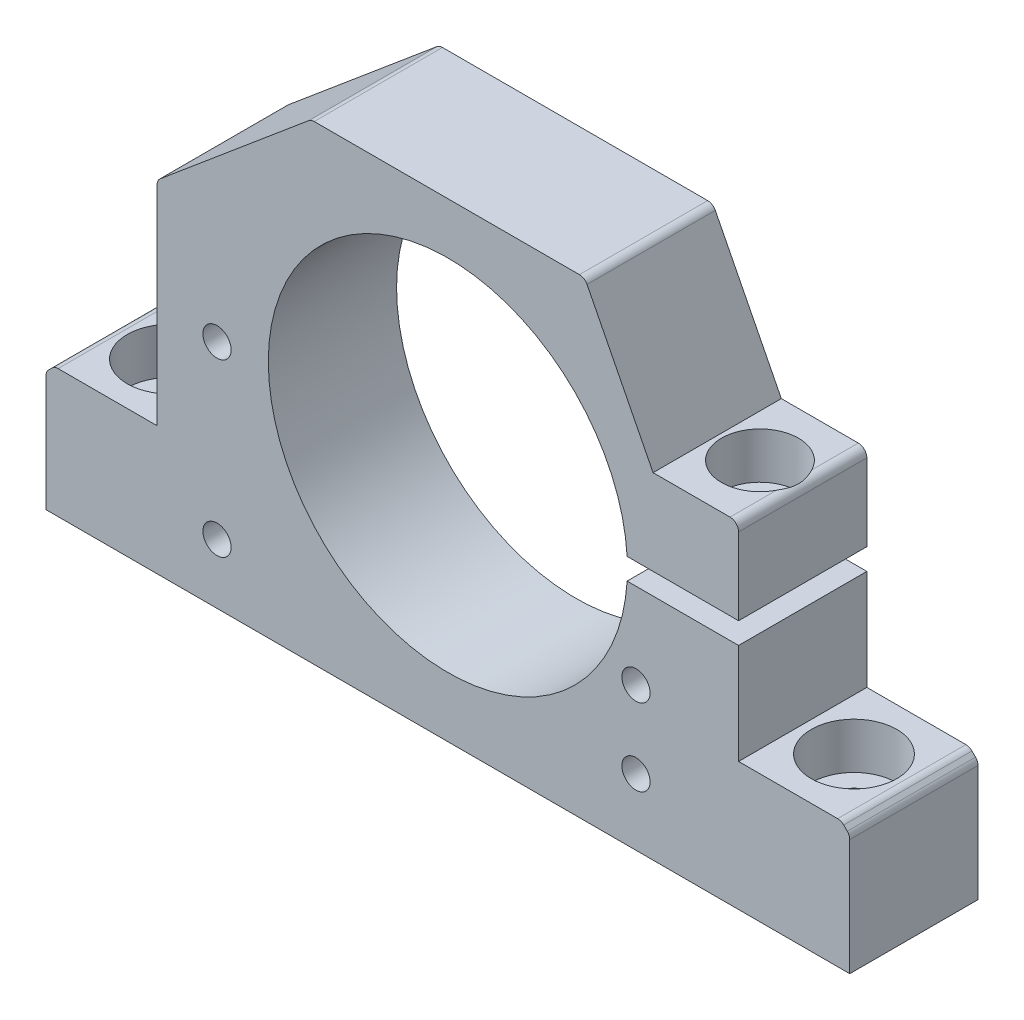
from build123d import *

# Parameters (mm, degrees)
SKETCH1_R                                            = 21
BOSS_EXTRUDE1_DEPTH                                  = 15
SKETCH2_W                                            = 42.201264836
SKETCH2_H                                            = 2.5
CUT_EXTRUDE1_DEPTH                                   = 15
CUT_EXTRUDE2_DEPTH                                   = 15
CBORE_SLOT_FOR_M5_HEX_SOCKET_HEAD_CAP_SC_D           = 5.5
CBORE_SLOT_FOR_M5_HEX_SOCKET_HEAD_CAP_SC_CBORE_D     = 10
CBORE_SLOT_FOR_M5_HEX_SOCKET_HEAD_CAP_SC_CBORE_DEPTH = 5.4
CBORE_FOR_M5_HEX_SOCKET_HEAD_CAP_SCREW1_D            = 5.5
CBORE_FOR_M5_HEX_SOCKET_HEAD_CAP_SCREW1_DEPTH        = 10
CBORE_FOR_M5_HEX_SOCKET_HEAD_CAP_SCREW1_CBORE_D      = 9
CBORE_FOR_M5_HEX_SOCKET_HEAD_CAP_SCREW1_CBORE_DEPTH  = 5.4
CHAMFER1_SIZE                                        = 1
M4_TAPPED_HOLE1_D                                    = 3.3
M5_TAPPED_HOLE1_D                                    = 4.2
M5_TAPPED_HOLE1_DEPTH                                = 18
M5_TAPPED_HOLE1_TIP                                  = 1.2618073
CHAMFER2_SIZE                                        = 18
CHAMFER2_SIZE2                                       = 15.103793361
FILLET1_R                                            = 1


with BuildPart() as part:
    # Sketch1 → Boss-Extrude1 (new body)
    with BuildSketch(Plane.XY):
        Polygon((47, -28), (-47, -28), (-47, -13), (-34, -13), (-34, 27), (34, 27), (34, -13), (47, -13), align=None)
        Circle(SKETCH1_R, mode=Mode.SUBTRACT)
    extrude(amount=BOSS_EXTRUDE1_DEPTH)

    # Sketch2 → Cut-Extrude1 (cut)
    with BuildSketch(Plane.XY.offset(15)):
        with Locations((34, 0)):
            Rectangle(SKETCH2_W, SKETCH2_H)
    extrude(amount=-CUT_EXTRUDE1_DEPTH, mode=Mode.SUBTRACT)

    # Sketch3 → Cut-Extrude2 (cut)
    with BuildSketch(Plane.XY.offset(15)):
        Polygon((34, 27), (16, 27), (24, 11.25), (34, 11.25), align=None)
    extrude(amount=-CUT_EXTRUDE2_DEPTH, mode=Mode.SUBTRACT)

    # CBORE SLOT for M5 Hex Socket Head Cap Screw1 (through all)
    with Locations(Plane(origin=(0, -13, 0), x_dir=(1, 0, 0), z_dir=(0, 1, 0))):
        with Locations((-40, -7.5), (40, -7.5)):
            CounterBoreHole(CBORE_SLOT_FOR_M5_HEX_SOCKET_HEAD_CAP_SC_D / 2, CBORE_SLOT_FOR_M5_HEX_SOCKET_HEAD_CAP_SC_CBORE_D / 2, CBORE_SLOT_FOR_M5_HEX_SOCKET_HEAD_CAP_SC_CBORE_DEPTH)

    # CBORE for M5 Hex Socket Head Cap Screw1
    with Locations(Plane(origin=(29, 11.25, 7.5), x_dir=(0, 0, 1), z_dir=(0, 1, 0))):
        with Locations((0, 0)):
            CounterBoreHole(CBORE_FOR_M5_HEX_SOCKET_HEAD_CAP_SCREW1_D / 2, CBORE_FOR_M5_HEX_SOCKET_HEAD_CAP_SCREW1_CBORE_D / 2, CBORE_FOR_M5_HEX_SOCKET_HEAD_CAP_SCREW1_CBORE_DEPTH, depth=CBORE_FOR_M5_HEX_SOCKET_HEAD_CAP_SCREW1_DEPTH)

    # Chamfer1
    chamfer1_edges = [part.edges().sort_by_distance(p)[0] for p in [
        (47, -13, 7.5),
        (-47, -13, 7.5),
    ]]
    chamfer(chamfer1_edges, length=CHAMFER1_SIZE)

    # M4 Tapped Hole1 (through all)
    with Locations(Plane(origin=(-27, -21, 15), x_dir=(1, 0, 0), z_dir=(0, 0, 1))):
        with Locations((0, 0), (0, 20), (49, 0.741264898), (49, 9.75)):
            Hole(M4_TAPPED_HOLE1_D / 2)

    # M5 Tapped Hole1
    with Locations(Plane(origin=(29, -1.25, 7.5), x_dir=(1, 0, 0), z_dir=(0, 1, 0))):
        with Locations((0, 0)):
            Hole(M5_TAPPED_HOLE1_D / 2, depth=M5_TAPPED_HOLE1_DEPTH)
            with Locations((0, 0, -(M5_TAPPED_HOLE1_DEPTH + M5_TAPPED_HOLE1_TIP / 2))):  # 118° drill point
                Cone(0, M5_TAPPED_HOLE1_D / 2, M5_TAPPED_HOLE1_TIP, mode=Mode.SUBTRACT)

    # Chamfer2
    chamfer2_edges = [part.edges().sort_by_distance(p)[0] for p in [
        (-34, 27, 7.5),
    ]]
    chamfer2_side = [part.faces().sort_by_distance(p)[0] for p in [
        (-9, 27, 7.5),
    ]]
    chamfer(chamfer2_edges, length=CHAMFER2_SIZE, length2=CHAMFER2_SIZE2, reference=chamfer2_side[0])

    # Fillet1
    # the kernel refuses this fillet: 1 mm, written as the material it takes off along each edge
    with BuildSketch(Plane(origin=(47, -14, -1.035533906), x_dir=(0, -1, 0), z_dir=(0, 0, 1)), Plane(origin=(-47, -14, -1.035533906), x_dir=(0.7071067811865497, 0.7071067811865454, 0), z_dir=(0, 0, 1)), Plane(origin=(-46, -13, -1.035533906), x_dir=(1, 0, 0), z_dir=(0, 0, 1)), Plane(origin=(46, -13, -1.035533906), x_dir=(0.7071067811865455, -0.7071067811865497, 0), z_dir=(0, 0, 1))) as fillet1_piece_1:
        with BuildLine():
            CenterArc((FILLET1_R * 0.414213562373, -FILLET1_R), FILLET1_R, 90, 45)
            Line((-FILLET1_R * 0.292893218813, -FILLET1_R * 0.292893218813), (0, 0))
            Line((0, 0), (FILLET1_R * 0.414213562373, 0))
        make_face()
    extrude(amount=17.071067812, mode=Mode.SUBTRACT)
    with BuildSketch(Plane(origin=(-34, 11.896206639, -1.165769145), x_dir=(0, -1, 0), z_dir=(0, 0, 1))) as fillet1_piece_2:
        with BuildLine():
            CenterArc((FILLET1_R * 0.466307658155, FILLET1_R), FILLET1_R, 220, 50)
            Line((-FILLET1_R * 0.299736784964, FILLET1_R * 0.357212390313), (0, 0))
            Line((0, 0), (FILLET1_R * 0.466307658155, 0))
        make_face()
    extrude(amount=17.331538291, mode=Mode.SUBTRACT)
    with BuildSketch(Plane(origin=(-16, 27, -0.909925586), x_dir=(-0.7660444431189759, -0.6427876096865418, 0), z_dir=(0, 0, 1))) as fillet1_piece_3:
        with BuildLine():
            CenterArc((FILLET1_R * 0.363970234266, FILLET1_R), FILLET1_R, 230, 40)
            Line((-FILLET1_R * 0.27881737542, FILLET1_R * 0.233955556881), (0, 0))
            Line((0, 0), (FILLET1_R * 0.363970234266, 0))
        make_face()
    extrude(amount=16.819851171, mode=Mode.SUBTRACT)
    with BuildSketch(Plane(origin=(34, 11.25, 17.5), x_dir=(-1, 0, 0), z_dir=(0, 0, -1))) as fillet1_piece_4:
        with BuildLine():
            CenterArc((FILLET1_R, -FILLET1_R), FILLET1_R, 90, 90)
            Line((0, -FILLET1_R), (0, 0))
            Line((0, 0), (FILLET1_R, 0))
        make_face()
    extrude(amount=20, mode=Mode.SUBTRACT)
    with BuildSketch(Plane(origin=(16, 27, 16.534173147), x_dir=(-1, 0, 0), z_dir=(0, 0, -1))) as fillet1_piece_5:
        with BuildLine():
            CenterArc((FILLET1_R * 0.613669258853, -FILLET1_R), FILLET1_R, 90, 63.072322149)
            Line((-FILLET1_R * 0.27790960924, -FILLET1_R * 0.547134543191), (0, 0))
            Line((0, 0), (FILLET1_R * 0.613669258853, 0))
        make_face()
    extrude(amount=18.068346294, mode=Mode.SUBTRACT)


solid = part.part
